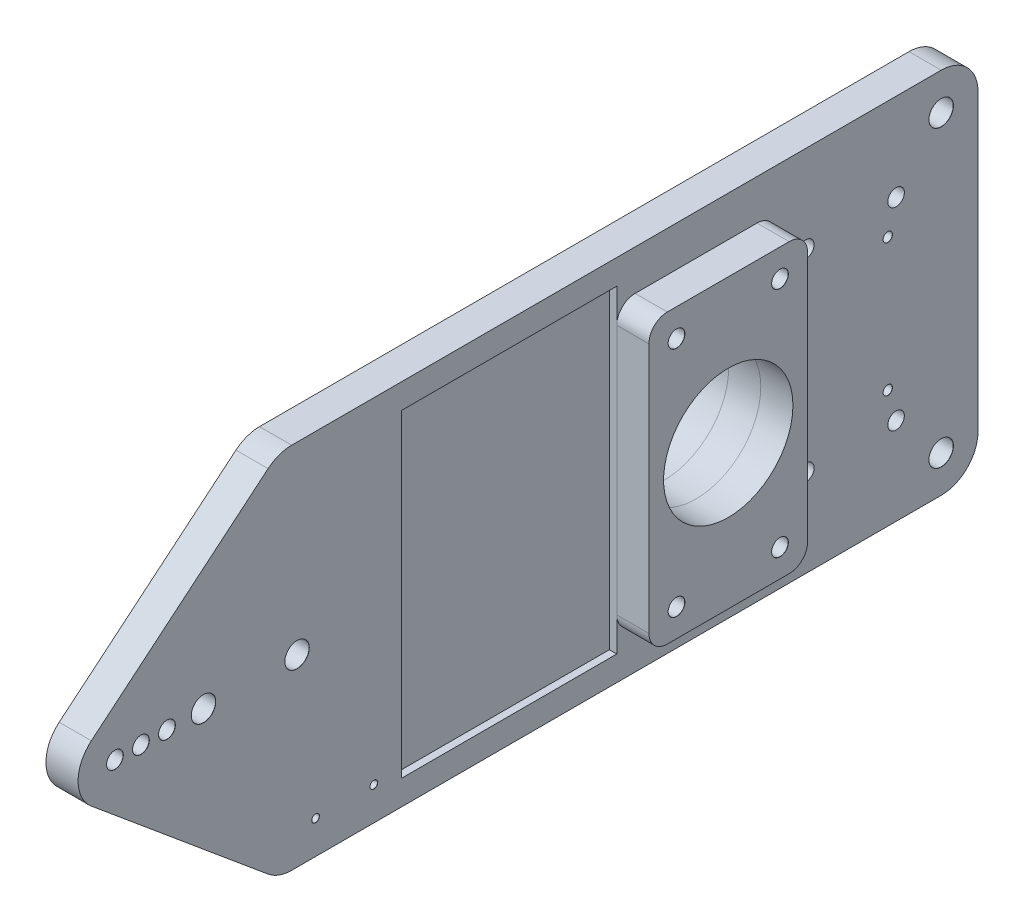
from build123d import *

# Parameters (mm, degrees)
SKETCH1_R                               = 2.25
SKETCH1_R_2                             = 17.5641
BOSS_EXTRUDE1_DEPTH                     = 4.365625
SKETCH2_W                               = 78.1
SKETCH2_H                               = 43.1
BOSS_EXTRUDE2_DEPTH                     = 8.73125
M4_CLEARANCE_HOLE2_AT_2_COUNT           = 2
M4_CLEARANCE_HOLE2_AT_2_PITCH           = 28.1
M4_CLEARANCE_HOLE2_AT_3_COUNT           = 2
M4_CLEARANCE_HOLE2_AT_3_PITCH           = 69.07401827
M4_CLEARANCE_HOLE2_AT_4_COUNT           = 2
M4_CLEARANCE_HOLE2_AT_4_PITCH           = 63.1
SKETCH24_W                              = 78.1
SKETCH24_H                              = 43.1
BOSS_EXTRUDE3_DEPTH                     = 8.73125
TAP_DRILL_FOR_M4X0_7_TAP1_AT_2_COUNT    = 2
TAP_DRILL_FOR_M4X0_7_TAP1_AT_2_PITCH    = 28.1
TAP_DRILL_FOR_M4X0_7_TAP1_AT_3_COUNT    = 2
TAP_DRILL_FOR_M4X0_7_TAP1_AT_3_PITCH    = 69.07401827
TAP_DRILL_FOR_M4X0_7_TAP1_AT_4_COUNT    = 2
TAP_DRILL_FOR_M4X0_7_TAP1_AT_4_PITCH    = 63.1
TAP_DRILL_FOR_M3X0_5_TAP1_AT_2_COUNT    = 2
TAP_DRILL_FOR_M3X0_5_TAP1_AT_2_PITCH    = 36
TAP_DRILL_FOR_M3X0_5_TAP1_AT_3_COUNT    = 2
TAP_DRILL_FOR_M3X0_5_TAP1_AT_3_PITCH    = 28
TAP_DRILL_FOR_M3X0_5_TAP1_AT_4_COUNT    = 2
TAP_DRILL_FOR_M3X0_5_TAP1_AT_4_PITCH    = 45.607017004
TAP_DRILL_FOR_M2_5X0_45_TAP2_AT_2_COUNT = 2
TAP_DRILL_FOR_M2_5X0_45_TAP2_AT_2_PITCH = 15.8
SKETCH3_R                               = 17.5641
CUT_EXTRUDE3_DEPTH                      = 183.403440316
M6_CLEARANCE_HOLE2_AT_2_COUNT           = 2
M6_CLEARANCE_HOLE2_AT_2_PITCH           = 80
SKETCH14_W                              = 86.5
SKETCH14_H                              = 58.5
CUT_EXTRUDE4_DEPTH                      = 2
FILLET4_R                               = 10
M4_CLEARANCE_HOLE1_AT_2_COUNT           = 2
M4_CLEARANCE_HOLE1_AT_2_PITCH           = 14.136551913
M4_CLEARANCE_HOLE1_AT_3_COUNT           = 2
M4_CLEARANCE_HOLE1_AT_3_PITCH           = 7.068275957
M6_CLEARANCE_HOLE1_AT_2_COUNT           = 2
M6_CLEARANCE_HOLE1_AT_2_PITCH           = 25.4
FILLET5_R                               = 5
FILLET6_R                               = 5


with BuildPart() as part:
    # Sketch1 → Boss-Extrude1 (new, symmetric)
    with BuildSketch(Plane.YZ):
        Polygon((0, 173.45), (-50, 113.45), (-50, -76.55), (50, -76.55), (50, 113.45), align=None)
        with Locations((-26.25, -54.3)):
            Circle(SKETCH1_R, mode=Mode.SUBTRACT)
        with Locations((-26.25, -29.8)):
            Circle(SKETCH1_R, mode=Mode.SUBTRACT)
        with Locations((26.25, -54.3)):
            Circle(SKETCH1_R, mode=Mode.SUBTRACT)
        with Locations((26.25, -29.8)):
            Circle(SKETCH1_R, mode=Mode.SUBTRACT)
        Circle(SKETCH1_R_2, mode=Mode.SUBTRACT)
    extrude(amount=BOSS_EXTRUDE1_DEPTH, both=True)


with BuildPart() as body_2:
    # Sketch2 → Boss-Extrude2 (new body)
    with BuildSketch(Plane.YZ.offset(4.365625)):
        Rectangle(SKETCH2_W, SKETCH2_H)
    extrude(amount=BOSS_EXTRUDE2_DEPTH)


with BuildPart() as m4_clearance_hole2_tool:
    # Sketch23 → M4 Clearance Hole2 (revolve)
    with BuildSketch(Plane(origin=(13.096875, -31.55, 14.05), x_dir=(0, 0, -1), z_dir=(0, 1, 0))):
        Polygon((0, 0), (0, 17.4625), (2.25, 17.4625), (2.25, 0.025), (2.275, 0), align=None)
    m4_clearance_hole2 = revolve(axis=Axis((19.446875, -31.55, 14.05), (-1, 0, 0)))


with BuildPart() as part_1:
    add(part.part)

    # M4 Clearance Hole2: cut by m4_clearance_hole2_tool
    add(m4_clearance_hole2_tool.part, mode=Mode.SUBTRACT)


with BuildPart() as body_2_1:
    add(body_2.part)

    # M4 Clearance Hole2: cut by m4_clearance_hole2_tool
    add(m4_clearance_hole2_tool.part, mode=Mode.SUBTRACT)


with BuildPart() as m4_clearance_hole2_at_2_tool:
    # M4 Clearance Hole2 at 2: M4 Clearance Hole2 ×2
    with Locations(*[(0, 0, -i * M4_CLEARANCE_HOLE2_AT_2_PITCH) for i in range(1, M4_CLEARANCE_HOLE2_AT_2_COUNT)]):
        add(m4_clearance_hole2)


with BuildPart() as part_2:
    add(part_1.part)

    # M4 Clearance Hole2 at 2: cut by m4_clearance_hole2_at_2_tool
    add(m4_clearance_hole2_at_2_tool.part, mode=Mode.SUBTRACT)


with BuildPart() as body_2_2:
    add(body_2_1.part)

    # M4 Clearance Hole2 at 2: cut by m4_clearance_hole2_at_2_tool
    add(m4_clearance_hole2_at_2_tool.part, mode=Mode.SUBTRACT)


with BuildPart() as m4_clearance_hole2_at_3_tool:
    # M4 Clearance Hole2 at 3: M4 Clearance Hole2 ×2
    with Locations(*[Vector(0, 0.9135128023552276, -0.40680998012966574) * (i * M4_CLEARANCE_HOLE2_AT_3_PITCH) for i in range(1, M4_CLEARANCE_HOLE2_AT_3_COUNT)]):
        add(m4_clearance_hole2)


with BuildPart() as part_3:
    add(part_2.part)

    # M4 Clearance Hole2 at 3: cut by m4_clearance_hole2_at_3_tool
    add(m4_clearance_hole2_at_3_tool.part, mode=Mode.SUBTRACT)


with BuildPart() as body_2_3:
    add(body_2_2.part)

    # M4 Clearance Hole2 at 3: cut by m4_clearance_hole2_at_3_tool
    add(m4_clearance_hole2_at_3_tool.part, mode=Mode.SUBTRACT)


with BuildPart() as m4_clearance_hole2_at_4_tool:
    # M4 Clearance Hole2 at 4: M4 Clearance Hole2 ×2
    with Locations(*[(0, i * M4_CLEARANCE_HOLE2_AT_4_PITCH, 0) for i in range(1, M4_CLEARANCE_HOLE2_AT_4_COUNT)]):
        add(m4_clearance_hole2)


with BuildPart() as part_4:
    add(part_3.part)

    # M4 Clearance Hole2 at 4: cut by m4_clearance_hole2_at_4_tool
    add(m4_clearance_hole2_at_4_tool.part, mode=Mode.SUBTRACT)

    # Sketch7 → Tap Drill for M3x0.5 Tap1 (revolve, cut)
    with BuildSketch(Plane(origin=(4.365625, -18, -24.05), x_dir=(0, 0, -1), z_dir=(0, 1, 0))):
        Polygon((0, 0), (0, 17.4625), (1.25, 17.4625), (1.25, 0.025), (1.275, 0), align=None)
    tap_drill_for_m3x0_5_tap1 = revolve(axis=Axis((10.715625, -18, -24.05), (-1, 0, 0)), mode=Mode.SUBTRACT)

    # Tap Drill for M3x0.5 Tap1 at 2: Tap Drill for M3x0.5 Tap1 ×2
    with Locations(*[(0, i * TAP_DRILL_FOR_M3X0_5_TAP1_AT_2_PITCH, 0) for i in range(1, TAP_DRILL_FOR_M3X0_5_TAP1_AT_2_COUNT)]):
        add(tap_drill_for_m3x0_5_tap1, mode=Mode.SUBTRACT)

    # Tap Drill for M3x0.5 Tap1 at 3: Tap Drill for M3x0.5 Tap1 ×2
    with Locations(*[(0, 0, -i * TAP_DRILL_FOR_M3X0_5_TAP1_AT_3_PITCH) for i in range(1, TAP_DRILL_FOR_M3X0_5_TAP1_AT_3_COUNT)]):
        add(tap_drill_for_m3x0_5_tap1, mode=Mode.SUBTRACT)

    # Tap Drill for M3x0.5 Tap1 at 4: Tap Drill for M3x0.5 Tap1 ×2
    with Locations(*[Vector(0, 0.7893522173763264, -0.6139406135149205) * (i * TAP_DRILL_FOR_M3X0_5_TAP1_AT_4_PITCH) for i in range(1, TAP_DRILL_FOR_M3X0_5_TAP1_AT_4_COUNT)]):
        add(tap_drill_for_m3x0_5_tap1, mode=Mode.SUBTRACT)

    # Sketch10 → Tap Drill for M2.5x0.45 Tap2 (revolve, cut)
    with BuildSketch(Plane(origin=(4.365625, -41, 103.325), x_dir=(0, 0, -1), z_dir=(0, 1, 0))):
        Polygon((0, 0), (0, 17.4625), (1.025, 17.4625), (1.025, 0.025), (1.05, 0), align=None)
    tap_drill_for_m2_5x0_45_tap2 = revolve(axis=Axis((10.715625, -41, 103.325), (-1, 0, 0)), mode=Mode.SUBTRACT)

    # Tap Drill for M2.5x0.45 Tap2 at 2: Tap Drill for M2.5x0.45 Tap2 ×2
    with Locations(*[(0, 0, -i * TAP_DRILL_FOR_M2_5X0_45_TAP2_AT_2_PITCH) for i in range(1, TAP_DRILL_FOR_M2_5X0_45_TAP2_AT_2_COUNT)]):
        add(tap_drill_for_m2_5x0_45_tap2, mode=Mode.SUBTRACT)

    # Sketch12 → M6 Clearance Hole2 (revolve, cut)
    with BuildSketch(Plane(origin=(4.365625, -40, -66.55), x_dir=(0, 0, -1), z_dir=(0, 1, 0))):
        Polygon((0, 0), (0, 17.4625), (3.3, 17.4625), (3.3, 0.025), (3.325, 0), align=None)
    m6_clearance_hole2 = revolve(axis=Axis((10.715625, -40, -66.55), (-1, 0, 0)), mode=Mode.SUBTRACT)

    # M6 Clearance Hole2 at 2: M6 Clearance Hole2 ×2
    with Locations(*[(0, i * M6_CLEARANCE_HOLE2_AT_2_PITCH, 0) for i in range(1, M6_CLEARANCE_HOLE2_AT_2_COUNT)]):
        add(m6_clearance_hole2, mode=Mode.SUBTRACT)

    # Sketch14 → Cut-Extrude4 (cut)
    with BuildSketch(Plane.YZ.offset(4.365625)):
        with Locations((0, 50.8)):
            Rectangle(SKETCH14_W, SKETCH14_H)
    extrude(amount=-CUT_EXTRUDE4_DEPTH, mode=Mode.SUBTRACT)

    # Fillet4
    fillet4_edges = [part_4.edges().sort_by_distance(p)[0] for p in [
        (0, 50, -76.55),
        (0, -50, -76.55),
        (0, 50, 113.45),
        (0, 0, 173.45),
        (0, -50, 113.45),
    ]]
    fillet(fillet4_edges, radius=FILLET4_R)

    # Sketch16 → M4 Clearance Hole1 (revolve, cut)
    with BuildSketch(Plane(origin=(4.365625, 0, 157.829500648), x_dir=(0, 0, -1), z_dir=(0, 1, 0))):
        Polygon((0, 0), (0, 17.4625), (2.25, 17.4625), (2.25, 0.025), (2.275, 0), align=None)
    m4_clearance_hole1 = revolve(axis=Axis((10.715625, 0, 157.829500648), (-1, 0, 0)), mode=Mode.SUBTRACT)

    # M4 Clearance Hole1 at 2: M4 Clearance Hole1 ×2
    with Locations(*[(0, 0, -i * M4_CLEARANCE_HOLE1_AT_2_PITCH) for i in range(1, M4_CLEARANCE_HOLE1_AT_2_COUNT)]):
        add(m4_clearance_hole1, mode=Mode.SUBTRACT)

    # M4 Clearance Hole1 at 3: M4 Clearance Hole1 ×2
    with Locations(*[(0, 0, -i * M4_CLEARANCE_HOLE1_AT_3_PITCH) for i in range(1, M4_CLEARANCE_HOLE1_AT_3_COUNT)]):
        add(m4_clearance_hole1, mode=Mode.SUBTRACT)

    # Sketch21 → M6 Clearance Hole1 (revolve, cut)
    with BuildSketch(Plane(origin=(4.365625, 0, 133.773931646), x_dir=(0, 0, -1), z_dir=(0, 1, 0))):
        Polygon((0, 0), (0, 17.4625), (3.3, 17.4625), (3.3, 0.025), (3.325, 0), align=None)
    m6_clearance_hole1 = revolve(axis=Axis((10.715625, 0, 133.773931646), (-1, 0, 0)), mode=Mode.SUBTRACT)

    # M6 Clearance Hole1 at 2: M6 Clearance Hole1 ×2
    with Locations(*[(0, 0, -i * M6_CLEARANCE_HOLE1_AT_2_PITCH) for i in range(1, M6_CLEARANCE_HOLE1_AT_2_COUNT)]):
        add(m6_clearance_hole1, mode=Mode.SUBTRACT)


with BuildPart() as body_2_4:
    add(body_2_3.part)

    # M4 Clearance Hole2 at 4: cut by m4_clearance_hole2_at_4_tool
    add(m4_clearance_hole2_at_4_tool.part, mode=Mode.SUBTRACT)


with BuildPart() as body_3:
    # Sketch24 → Boss-Extrude3 (new body)
    with BuildSketch(Plane(origin=(-4.365625, 0, 0), x_dir=(0, -1, 0), z_dir=(-1, 0, 0))):
        Rectangle(SKETCH24_W, SKETCH24_H)
    extrude(amount=BOSS_EXTRUDE3_DEPTH)

    # Sketch27 → Tap Drill for M4x0.7 Tap1 (revolve, cut)
    with BuildSketch(Plane(origin=(-13.096875, 31.55, 14.05), x_dir=(0, 0, 1), z_dir=(0, 1, 0))):
        Polygon((0, 0), (0, 9.722670021), (1.65, 8.73125), (1.65, 0.025), (1.675, 0), align=None)
    tap_drill_for_m4x0_7_tap1 = revolve(axis=Axis((-19.446875, 31.55, 14.05), (1, 0, 0)), mode=Mode.SUBTRACT)

    # Tap Drill for M4x0.7 Tap1 at 2: Tap Drill for M4x0.7 Tap1 ×2
    with Locations(*[(0, 0, -i * TAP_DRILL_FOR_M4X0_7_TAP1_AT_2_PITCH) for i in range(1, TAP_DRILL_FOR_M4X0_7_TAP1_AT_2_COUNT)]):
        add(tap_drill_for_m4x0_7_tap1, mode=Mode.SUBTRACT)

    # Tap Drill for M4x0.7 Tap1 at 3: Tap Drill for M4x0.7 Tap1 ×2
    with Locations(*[Vector(0, -0.9135128023552276, -0.40680998012966574) * (i * TAP_DRILL_FOR_M4X0_7_TAP1_AT_3_PITCH) for i in range(1, TAP_DRILL_FOR_M4X0_7_TAP1_AT_3_COUNT)]):
        add(tap_drill_for_m4x0_7_tap1, mode=Mode.SUBTRACT)

    # Tap Drill for M4x0.7 Tap1 at 4: Tap Drill for M4x0.7 Tap1 ×2
    with Locations(*[(0, -i * TAP_DRILL_FOR_M4X0_7_TAP1_AT_4_PITCH, 0) for i in range(1, TAP_DRILL_FOR_M4X0_7_TAP1_AT_4_COUNT)]):
        add(tap_drill_for_m4x0_7_tap1, mode=Mode.SUBTRACT)


with BuildPart() as cut_extrude3_tool:
    # Sketch3 → Cut-Extrude3 (new, through all)
    with BuildSketch(Plane.YZ.offset(13.096875)):
        Circle(SKETCH3_R)
    extrude(amount=-CUT_EXTRUDE3_DEPTH)


with BuildPart() as body_2_5:
    add(body_2_4.part)

    # Cut-Extrude3: cut by cut_extrude3_tool
    add(cut_extrude3_tool.part, mode=Mode.SUBTRACT)

    # Fillet6
    fillet6_edges = [body_2_5.edges().sort_by_distance(p)[0] for p in [
        (8.73125, -39.05, 21.55),
        (8.73125, 39.05, -21.55),
        (8.73125, -39.05, -21.55),
        (8.73125, 39.05, 21.55),
    ]]
    fillet(fillet6_edges, radius=FILLET6_R)


with BuildPart() as body_3_1:
    add(body_3.part)

    # Cut-Extrude3: cut by cut_extrude3_tool
    add(cut_extrude3_tool.part, mode=Mode.SUBTRACT)

    # Fillet5
    fillet5_edges = [body_3_1.edges().sort_by_distance(p)[0] for p in [
        (-8.73125, -39.05, 21.55),
        (-8.73125, -39.05, -21.55),
        (-8.73125, 39.05, -21.55),
        (-8.73125, 39.05, 21.55),
    ]]
    fillet(fillet5_edges, radius=FILLET5_R)


solid = Compound([part_4.part, body_2_5.part, body_3_1.part])
